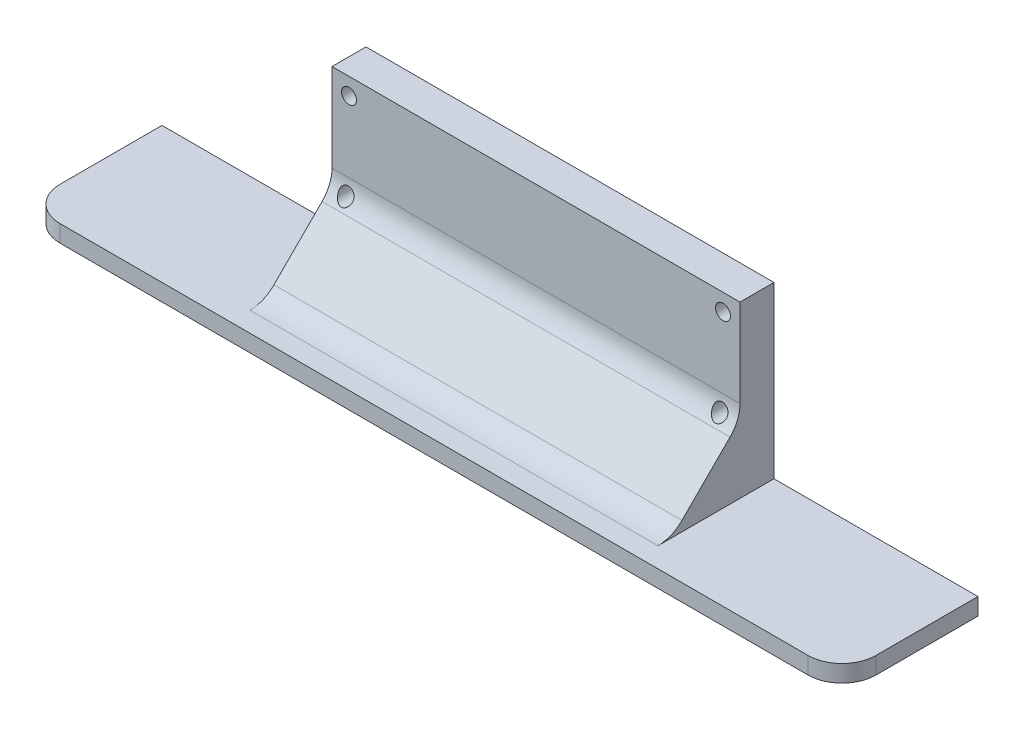
from build123d import *

# Parameters (mm, degrees)
SKETCH_1_W               = 240
SKETCH_1_H               = 40
EXTRUDE_1_DEPTH          = 5
SKETCH_2_W               = 120
SKETCH_2_H               = 10
EXTRUDE_2_DEPTH          = 50
CHAMFER_1_SIZE           = 20
FILLET_4_R               = 10
CUT_EXTRUDE_1_DEPTH      = 136.369863707
CUT_EXTRUDE_1_DEPTH_BACK = 136.369863707
SKETCH_4_R               = 2.2
FILLET_5_R               = 10


with BuildPart() as part:
    # 草图1 → 凸台-拉伸1 (new body)
    with BuildSketch(Plane(origin=(0, 0, 0), x_dir=(1, 0, 0), z_dir=(0, 1, 0))):
        Rectangle(SKETCH_1_W, SKETCH_1_H)
    extrude(amount=EXTRUDE_1_DEPTH)

    # 草图2 → 凸台-拉伸2 (add)
    with BuildSketch(Plane(origin=(0, 5, 0), x_dir=(1, 0, 0), z_dir=(0, 1, 0))):
        with Locations((0, 15)):
            Rectangle(SKETCH_2_W, SKETCH_2_H)
    extrude(amount=EXTRUDE_2_DEPTH)

    # 倒角1
    chamfer_1_edges = [part.edges().sort_by_distance(p)[0] for p in [
        (0, 5, -10),
    ]]
    chamfer(chamfer_1_edges, length=CHAMFER_1_SIZE)

    # 圆角4
    fillet_4_edges = [part.edges().sort_by_distance(p)[0] for p in [
        (0, 5, 10),
        (0, 25, -10),
    ]]
    fillet(fillet_4_edges, radius=FILLET_4_R)

    # 草图4 → 切除-拉伸1 (cut, two sides: drawn at the far end of the back side and taken through both)
    with BuildSketch(Plane.XY.offset(-10).offset(-CUT_EXTRUDE_1_DEPTH_BACK)):
        with Locations((-55, 50)):
            Circle(SKETCH_4_R)
        with Locations((55, 50)):
            Circle(SKETCH_4_R)
        with Locations((-55, 25)):
            Circle(SKETCH_4_R)
        with Locations((55, 25)):
            Circle(SKETCH_4_R)
    extrude(amount=CUT_EXTRUDE_1_DEPTH + CUT_EXTRUDE_1_DEPTH_BACK, mode=Mode.SUBTRACT)

    # 圆角5
    fillet_5_edges = [part.edges().sort_by_distance(p)[0] for p in [
        (-120, 2.5, 20),
        (120, 2.5, 20),
    ]]
    fillet(fillet_5_edges, radius=FILLET_5_R)


solid = part.part
